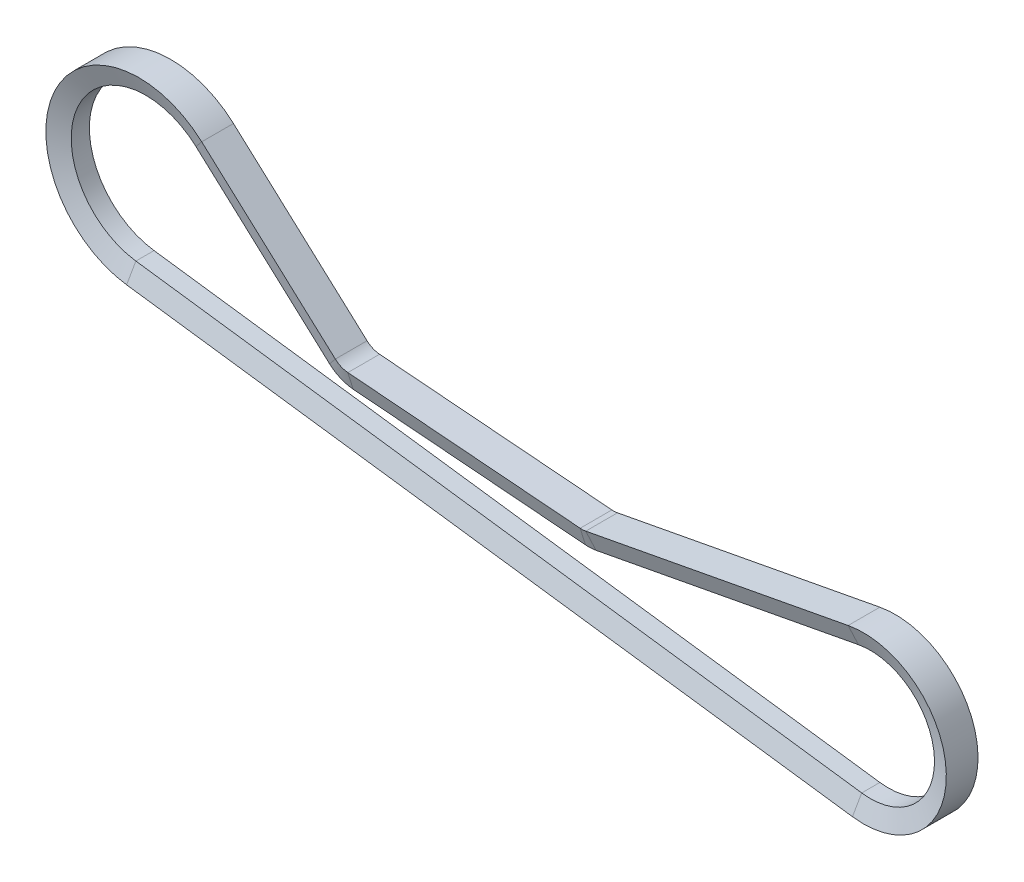
from build123d import *


with BuildPart() as part:
    # Sweep1: sweep along a path in Sketch2
    with BuildLine(Plane.XY) as sweep1_path:
        Line((-3.318448836, -24.652657545), (-221.330005374, 4.693476626))
        ThreePointArc((-221.330005374, 4.693476626), (-242.980969702, 44.255719755), (-198.772112319, 53.172684856))
        Line((-198.772112319, 53.172684856), (-158.635278486, 16.728085546))
        ThreePointArc((-158.635278486, 16.728085546), (-156.890130245, 15.60220816), (-154.875048875, 15.099625483))
        Line((-154.875048875, 15.099625483), (-85.099812635, 9.494591351))
        ThreePointArc((-85.099812635, 9.494591351), (-84.25426535, 9.48315563), (-83.414696045, 9.584172305))
        Line((-83.414696045, 9.584172305), (-4.60935679, 24.444211108))
        ThreePointArc((-4.60935679, 24.444211108), (24.866406121, 0.653814435), (-3.318448836, -24.652657545))
    # Sketch3 → Sweep1 (sweep)
    with BuildSketch(Plane(origin=(-4.60935679, 24.444211108, 0), x_dir=(0.18530077521288552, -0.9826818522316894, 0), z_dir=(0.9826818522316894, 0.18530077521288552, 0))):
        Polygon((0, -4.7625), (0, 4.7625), (5.588, 2.728634331), (5.588, -2.728634331), align=None)
    sweep(path=sweep1_path.line)


solid = part.part
